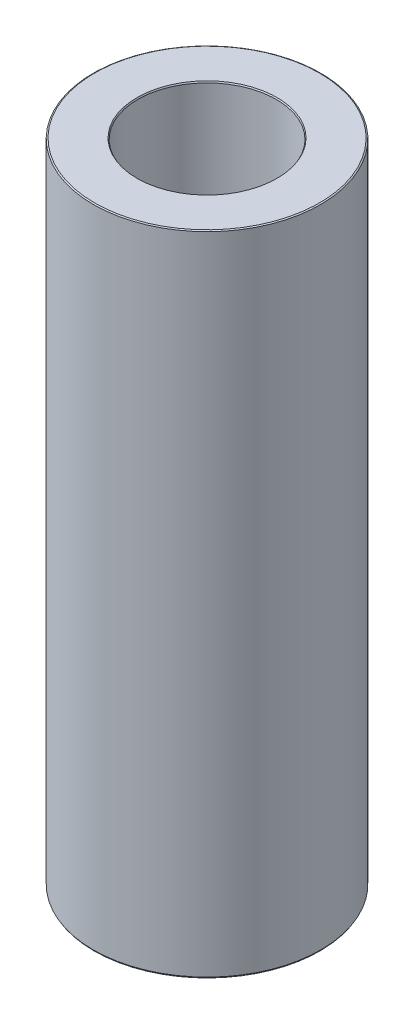
from build123d import *
from OCP.BRepFilletAPI import BRepFilletAPI_MakeChamfer

# Parameters (mm, degrees)
SKETCH1_R           = 45
BOSS_EXTRUDE1_DEPTH = 256.197425095
SKETCH2_R           = 27.411687321
CUT_EXTRUDE1_DEPTH  = 264.983182466
CHAMFER1_SIZE       = 0.290574505
CHAMFER1_SIZE2      = 0.503289806


with BuildPart() as part:
    # Sketch1 → Boss-Extrude1 (new body)
    with BuildSketch(Plane(origin=(0, 0, 0), x_dir=(1, 0, 0), z_dir=(0, 1, 0))):
        Circle(SKETCH1_R)
    extrude(amount=BOSS_EXTRUDE1_DEPTH)

    # Sketch2 → Cut-Extrude1 (cut, through all)
    with BuildSketch(Plane(origin=(0, 0, 0), x_dir=(1, 0, 0), z_dir=(0, 1, 0))):
        Circle(SKETCH2_R)
    extrude(amount=CUT_EXTRUDE1_DEPTH, mode=Mode.SUBTRACT)

    # Chamfer1: one chamfer whose edges measure the first distance from different faces: ONE call of the kernel's chamfer builder (chamfer() names one face for all edges)
    chamfer1_edges_1 = [part.edges().sort_by_distance(p)[0] for p in [
        (-27.411687321, 256.197425095, 0),
    ]]
    chamfer1_side_1 = [part.faces().sort_by_distance(p)[0] for p in [
        (-43.727207794, 256.197425095, 0),
    ]]
    chamfer1_edges_2 = [part.edges().sort_by_distance(p)[0] for p in [
        (-27.411687321, 0, 0),
    ]]
    chamfer1_side_2 = [part.faces().sort_by_distance(p)[0] for p in [
        (-27.411687321, 128.098712547, 0),
    ]]
    chamfer1_edges_3 = [part.edges().sort_by_distance(p)[0] for p in [
        (-45, 0, 0),
    ]]
    chamfer1_side_3 = [part.faces().sort_by_distance(p)[0] for p in [
        (-43.727207794, 0, 0),
    ]]
    chamfer1_edges_4 = [part.edges().sort_by_distance(p)[0] for p in [
        (-45, 256.197425095, 0),
    ]]
    chamfer1_side_4 = [part.faces().sort_by_distance(p)[0] for p in [
        (-45, 128.098712547, 0),
    ]]
    chamfer1 = BRepFilletAPI_MakeChamfer(part.part.solid().wrapped)
    for e in chamfer1_edges_1:
        chamfer1.Add(CHAMFER1_SIZE, CHAMFER1_SIZE2, e.wrapped, chamfer1_side_1[0].wrapped)  # the first distance lies on this face
    for e in chamfer1_edges_2:
        chamfer1.Add(CHAMFER1_SIZE, CHAMFER1_SIZE2, e.wrapped, chamfer1_side_2[0].wrapped)  # the first distance lies on this face
    for e in chamfer1_edges_3:
        chamfer1.Add(CHAMFER1_SIZE, CHAMFER1_SIZE2, e.wrapped, chamfer1_side_3[0].wrapped)  # the first distance lies on this face
    for e in chamfer1_edges_4:
        chamfer1.Add(CHAMFER1_SIZE, CHAMFER1_SIZE2, e.wrapped, chamfer1_side_4[0].wrapped)  # the first distance lies on this face
    add(Compound.cast(chamfer1.Shape()), mode=Mode.REPLACE)


solid = part.part
